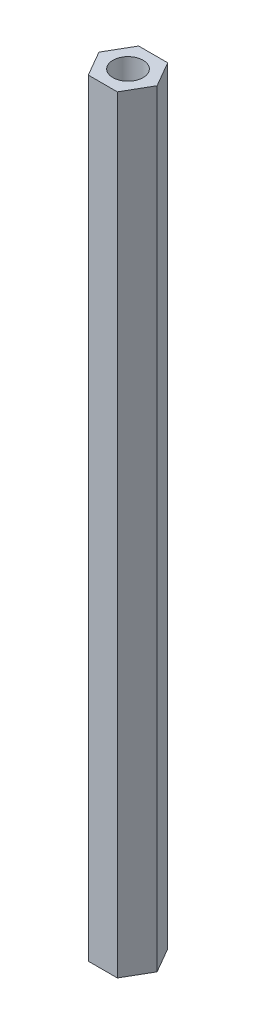
from build123d import *

# Parameters (mm, degrees)
BOSS_EXTRUDE1_DEPTH = 76.2
SKETCH2_R           = 1.5
CUT_EXTRUDE1_DEPTH  = 77.295631155


with BuildPart() as part:
    # Sketch1 → Boss-Extrude1 (new body)
    with BuildSketch(Plane(origin=(0, 0, 0), x_dir=(1, 0, 0), z_dir=(0, 1, 0))):
        Polygon((2.886751346, 0), (1.443375673, 2.5), (-1.443375673, 2.5), (-2.886751346, 0), (-1.443375673, -2.5), (1.443375673, -2.5), align=None)
    extrude(amount=BOSS_EXTRUDE1_DEPTH)

    # Sketch2 → Cut-Extrude1 (cut, through all)
    with BuildSketch(Plane(origin=(0, 76.2, 0), x_dir=(1, 0, 0), z_dir=(0, 1, 0))):
        Circle(SKETCH2_R)
    extrude(amount=-CUT_EXTRUDE1_DEPTH, mode=Mode.SUBTRACT)


solid = part.part
